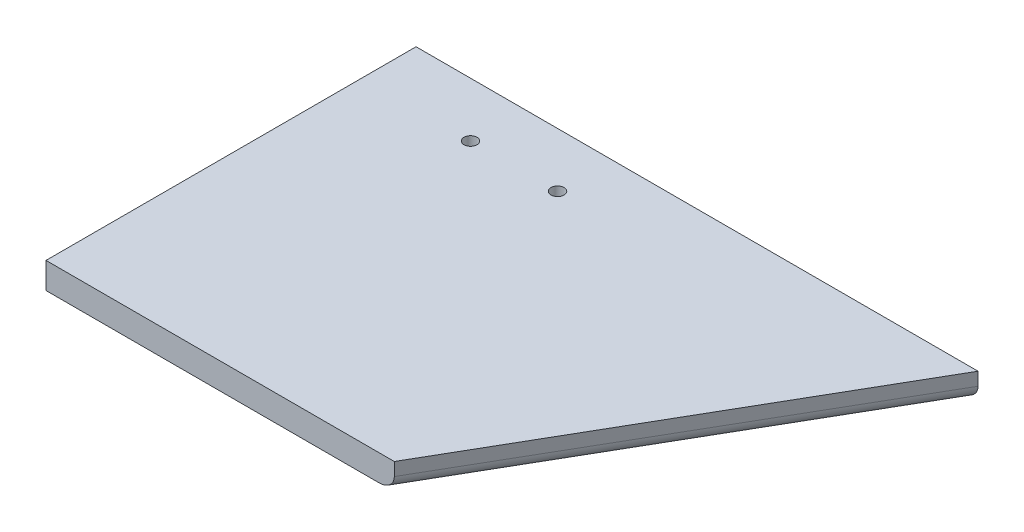
from build123d import *

# Parameters (mm, degrees)
BOSS_EXTRUDE1_DEPTH = 6
FILLET1_R           = 3
SKETCH2_R           = 1.5
CUT_EXTRUDE1_DEPTH  = 117.880280629


with BuildPart() as part:
    # Sketch1 → Boss-Extrude1 (new body)
    with BuildSketch(Plane(origin=(0, 0, 0), x_dir=(1, 0, 0), z_dir=(0, 1, 0))):
        Polygon((0, 0), (49.074772881, 85), (0, 85), (-80, 85), (-80, 0), align=None)
    extrude(amount=BOSS_EXTRUDE1_DEPTH)

    # Fillet1
    fillet1_edges = [part.edges().sort_by_distance(p)[0] for p in [
        (24.537386441, 0, -42.5),
    ]]
    fillet(fillet1_edges, radius=FILLET1_R)

    # Sketch2 → Cut-Extrude1 (cut, through all)
    with BuildSketch(Plane(origin=(0, 6, 0), x_dir=(1, 0, 0), z_dir=(0, 1, 0))):
        with Locations((-55, 72.5)):
            Circle(SKETCH2_R)
        with Locations((-35, 72.5)):
            Circle(SKETCH2_R)
    extrude(amount=-CUT_EXTRUDE1_DEPTH, mode=Mode.SUBTRACT)


solid = part.part
